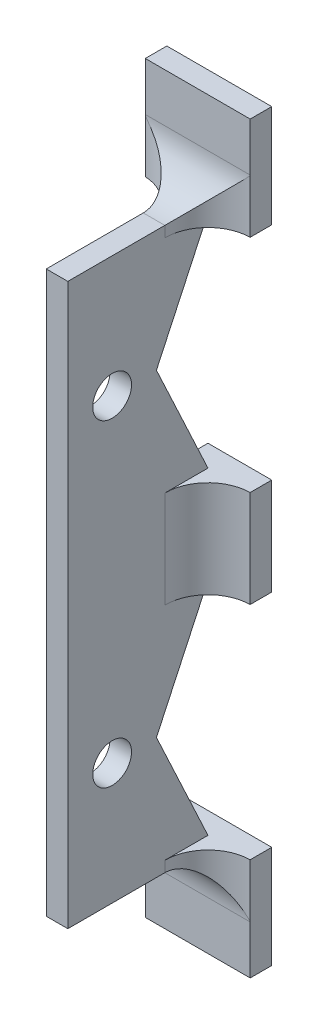
from build123d import *

# Parameters (mm, degrees)
SKETCH2_W             = 5.91625
SKETCH2_H             = 9
BOSS_EXTRUDE1_DEPTH   = 2
SKETCH2_W_2           = 9.732
SKETCH2_H_2           = 9.5
BOSS_EXTRUDE1_2_DEPTH = 2
BOSS_EXTRUDE1_3_DEPTH = 2
SKETCH3_W             = 2
SKETCH3_H             = 1
BOSS_EXTRUDE2_DEPTH   = 13
FILLET1_R             = 4
CUT_EXTRUDE1_DEPTH    = 83.031058661
M3_CLEARANCE_HOLE2_D  = 3.6


with BuildPart() as part:
    # Sketch2 → Boss-Extrude1 (new body)
    with BuildSketch(Plane.XY.offset(11.211435671)):
        with Locations((2.267401673, -43.012787822)):
            Rectangle(SKETCH2_W, SKETCH2_H)
    extrude(amount=BOSS_EXTRUDE1_DEPTH)



with BuildPart() as body_2:
    # Sketch2 → Boss-Extrude1 2 (new body)
    with BuildSketch(Plane.XY.offset(11.211435671)):
        with Locations((0.359526673, -72.762787822)):
            Rectangle(SKETCH2_W_2, SKETCH2_H_2)
    extrude(amount=BOSS_EXTRUDE1_2_DEPTH)


with BuildPart() as body_3:
    # Sketch2 → Boss-Extrude1 3 (new body)
    with BuildSketch(Plane.XY.offset(11.211435671)):
        with Locations((0.359526673, -13.262787822)):
            Rectangle(SKETCH2_W_2, SKETCH2_H_2)
    extrude(amount=BOSS_EXTRUDE1_3_DEPTH)


with BuildPart() as part_1:
    add(part.part)

    add(body_2.part)  # Boss-Extrude2 merges body 2

    add(body_3.part)  # Boss-Extrude2 merges body 3
    # Sketch3 → Boss-Extrude2 (add)
    with BuildSketch(Plane.XY.offset(13.211435671)):
        Polygon((-0.690723327, -17.012787822), (-0.690723327, -38.512787822), (-0.690723327, -47.512787822), (-0.690723327, -68.012787822), (1.309276673, -68.012787822), (1.309276673, -17.012787822), align=None)
        with Locations((0.309276673, -68.512787822)):
            Rectangle(SKETCH3_W, SKETCH3_H)
    extrude(amount=BOSS_EXTRUDE2_DEPTH)

    # Fillet1
    # the kernel refuses this fillet: 4 mm, written as the material it adds along each edge
    with BuildSketch(Plane(origin=(-0.690723327, -17.012787822, 13.211435671), x_dir=(0, 0, 1), z_dir=(0, -1, 0)), Plane(origin=(-0.690723327, -68.012787822, 13.211435671), x_dir=(0, 0, 1), z_dir=(0, -1, 0))) as fillet1_piece_1:
        with BuildLine():
            CenterArc((3.995754239, 4), FILLET1_R, 182.64012102, 87.35987898)
            Line((0, 3.81575), (0, 0))
            Line((0, 0), (3.995754239, 0))
        make_face()
    extrude(amount=1)
    with BuildSketch(Plane(origin=(1.309276673, -17.012787822, 13.211435671), x_dir=(0, 1, 0), z_dir=(-1, 0, 0))) as fillet1_piece_2:
        with BuildLine():
            CenterArc((FILLET1_R, -FILLET1_R), FILLET1_R, 90, 90)
            Line((0, -FILLET1_R), (0, 0))
            Line((0, 0), (FILLET1_R, 0))
        make_face()
    extrude(amount=2)
    with BuildSketch(Plane(origin=(1.309276673, -17.012787822, 13.211435671), x_dir=(1, 0, 0), z_dir=(0, -1, 0))) as fillet1_piece_3_section:
        with BuildLine():
            CenterArc((FILLET1_R, FILLET1_R), FILLET1_R, 180, 90)
            Line((0, FILLET1_R), (0, 0))
            Line((0, 0), (FILLET1_R, 0))
        make_face()
    fillet1_piece_3 = extrude(amount=1, mode=Mode.PRIVATE)
    fillet1_piece_3 = split(fillet1_piece_3, bisect_by=Plane(origin=(5.225526673, -17.012787822, 13.211435671), z_dir=(-1, 0, 0)), keep=Keep.TOP, mode=Mode.PRIVATE)
    add(fillet1_piece_3)
    with BuildSketch(Plane(origin=(1.309276673, -38.512787822, 13.211435671), x_dir=(1, 0, 0), z_dir=(0, -1, 0))) as fillet1_piece_4_section:
        with BuildLine():
            CenterArc((FILLET1_R, FILLET1_R), FILLET1_R, 180, 90)
            Line((0, FILLET1_R), (0, 0))
            Line((0, 0), (FILLET1_R, 0))
        make_face()
    fillet1_piece_4 = extrude(amount=9, mode=Mode.PRIVATE)
    fillet1_piece_4 = split(fillet1_piece_4, bisect_by=Plane(origin=(5.225526673, -38.512787822, 13.211435671), z_dir=(-1, 0, 0)), keep=Keep.TOP, mode=Mode.PRIVATE)
    add(fillet1_piece_4)
    with BuildSketch(Plane(origin=(1.309276673, -68.012787822, 13.211435671), x_dir=(1, 0, 0), z_dir=(0, -1, 0))) as fillet1_piece_5_section:
        with BuildLine():
            CenterArc((FILLET1_R, FILLET1_R), FILLET1_R, 180, 90)
            Line((0, FILLET1_R), (0, 0))
            Line((0, 0), (FILLET1_R, 0))
        make_face()
    fillet1_piece_5 = extrude(amount=1, mode=Mode.PRIVATE)
    fillet1_piece_5 = split(fillet1_piece_5, bisect_by=Plane(origin=(5.225526673, -68.012787822, 13.211435671), z_dir=(-1, 0, 0)), keep=Keep.TOP, mode=Mode.PRIVATE)
    add(fillet1_piece_5)
    with BuildSketch(Plane(origin=(-0.690723327, -69.012787822, 13.211435671), x_dir=(0, 0, 1), z_dir=(1, 0, 0))) as fillet1_piece_6:
        with BuildLine():
            CenterArc((FILLET1_R, FILLET1_R), FILLET1_R, 180, 90)
            Line((0, FILLET1_R), (0, 0))
            Line((0, 0), (FILLET1_R, 0))
        make_face()
    extrude(amount=2)
    with BuildSketch(Plane(origin=(-0.690723327, -7.023402225, 13.211435671), x_dir=(0, 0, 1), z_dir=(0, -1, 0))) as fillet1_piece_7a_section:
        with BuildLine():
            CenterArc((3.995754239, 4), FILLET1_R, 182.64012102, 87.35987898)
            Line((0, 3.81575), (0, 0))
            Line((0, 0), (3.995754239, 0))
        make_face()
    fillet1_piece_7a = extrude(amount=10.989385597, mode=Mode.PRIVATE)
    fillet1_piece_7a = split(fillet1_piece_7a, bisect_by=Plane(origin=(-0.690723327, -17.012787822, 13.211435671), z_dir=(0, 1, 0)), keep=Keep.TOP, mode=Mode.PRIVATE)
    fillet1_piece_7a = split(fillet1_piece_7a, bisect_by=Plane(origin=(-0.690723327, -8.512787822, 13.211435671), z_dir=(0, -1, 0)), keep=Keep.TOP, mode=Mode.PRIVATE)
    with BuildSketch(Plane(origin=(1.309276673, -17.012787822, 13.211435671), x_dir=(0, 1, 0), z_dir=(-1, 0, 0))) as fillet1_piece_7b_section:
        with BuildLine():
            CenterArc((FILLET1_R, -FILLET1_R), FILLET1_R, 90, 90)
            Line((0, -FILLET1_R), (0, 0))
            Line((0, 0), (FILLET1_R, 0))
        make_face()
    fillet1_piece_7b = extrude(amount=12, mode=Mode.PRIVATE)
    fillet1_piece_7b = split(fillet1_piece_7b, bisect_by=Plane(origin=(-0.690723327, -17.012787822, 13.211435671), z_dir=(-1, 0, 0)), keep=Keep.TOP, mode=Mode.PRIVATE)
    fillet1_piece_7b = split(fillet1_piece_7b, bisect_by=Plane(origin=(-4.506473327, -17.012787822, 13.211435671), z_dir=(1, 0, 0)), keep=Keep.TOP, mode=Mode.PRIVATE)
    fillet1_piece_7 = fillet1_piece_7a & fillet1_piece_7b
    add(fillet1_piece_7)
    with BuildSketch(Plane(origin=(1.309276673, -7.012787822, 13.211435671), x_dir=(1, 0, 0), z_dir=(0, -1, 0))) as fillet1_piece_8a_section:
        with BuildLine():
            CenterArc((FILLET1_R, FILLET1_R), FILLET1_R, 180, 90)
            Line((0, FILLET1_R), (0, 0))
            Line((0, 0), (FILLET1_R, 0))
        make_face()
    fillet1_piece_8a = extrude(amount=11, mode=Mode.PRIVATE)
    fillet1_piece_8a = split(fillet1_piece_8a, bisect_by=Plane(origin=(1.309276673, -17.012787822, 13.211435671), z_dir=(0, 1, 0)), keep=Keep.TOP, mode=Mode.PRIVATE)
    fillet1_piece_8a = split(fillet1_piece_8a, bisect_by=Plane(origin=(1.309276673, -8.512787822, 13.211435671), z_dir=(0, -1, 0)), keep=Keep.TOP, mode=Mode.PRIVATE)
    with BuildSketch(Plane(origin=(11.309276673, -17.012787822, 13.211435671), x_dir=(0, 1, 0), z_dir=(-1, 0, 0))) as fillet1_piece_8b_section:
        with BuildLine():
            CenterArc((FILLET1_R, -FILLET1_R), FILLET1_R, 90, 90)
            Line((0, -FILLET1_R), (0, 0))
            Line((0, 0), (FILLET1_R, 0))
        make_face()
    fillet1_piece_8b = extrude(amount=12, mode=Mode.PRIVATE)
    fillet1_piece_8b = split(fillet1_piece_8b, bisect_by=Plane(origin=(1.309276673, -17.012787822, 13.211435671), z_dir=(1, 0, 0)), keep=Keep.TOP, mode=Mode.PRIVATE)
    fillet1_piece_8b = split(fillet1_piece_8b, bisect_by=Plane(origin=(5.225526673, -17.012787822, 13.211435671), z_dir=(-1, 0, 0)), keep=Keep.TOP, mode=Mode.PRIVATE)
    fillet1_piece_8 = fillet1_piece_8a & fillet1_piece_8b
    add(fillet1_piece_8)
    with BuildSketch(Plane(origin=(-0.690723327, -68.012787822, 13.211435671), x_dir=(0, 0, 1), z_dir=(0, -1, 0))) as fillet1_piece_9a_section:
        with BuildLine():
            CenterArc((3.995754239, 4), FILLET1_R, 182.64012102, 87.35987898)
            Line((0, 3.81575), (0, 0))
            Line((0, 0), (3.995754239, 0))
        make_face()
    fillet1_piece_9a = extrude(amount=10.989385597, mode=Mode.PRIVATE)
    fillet1_piece_9a = split(fillet1_piece_9a, bisect_by=Plane(origin=(-0.690723327, -69.012787822, 13.211435671), z_dir=(0, -1, 0)), keep=Keep.TOP, mode=Mode.PRIVATE)
    fillet1_piece_9a = split(fillet1_piece_9a, bisect_by=Plane(origin=(-0.690723327, -77.512787822, 13.211435671), z_dir=(0, 1, 0)), keep=Keep.TOP, mode=Mode.PRIVATE)
    with BuildSketch(Plane(origin=(-10.690723327, -69.012787822, 13.211435671), x_dir=(0, 0, 1), z_dir=(1, 0, 0))) as fillet1_piece_9b_section:
        with BuildLine():
            CenterArc((FILLET1_R, FILLET1_R), FILLET1_R, 180, 90)
            Line((0, FILLET1_R), (0, 0))
            Line((0, 0), (FILLET1_R, 0))
        make_face()
    fillet1_piece_9b = extrude(amount=12, mode=Mode.PRIVATE)
    fillet1_piece_9b = split(fillet1_piece_9b, bisect_by=Plane(origin=(-0.690723327, -69.012787822, 13.211435671), z_dir=(-1, 0, 0)), keep=Keep.TOP, mode=Mode.PRIVATE)
    fillet1_piece_9b = split(fillet1_piece_9b, bisect_by=Plane(origin=(-4.506473327, -69.012787822, 13.211435671), z_dir=(1, 0, 0)), keep=Keep.TOP, mode=Mode.PRIVATE)
    fillet1_piece_9 = fillet1_piece_9a & fillet1_piece_9b
    add(fillet1_piece_9)
    with BuildSketch(Plane(origin=(-0.690723327, -69.012787822, 13.211435671), x_dir=(0, 0, 1), z_dir=(1, 0, 0))) as fillet1_piece_10a_section:
        with BuildLine():
            CenterArc((FILLET1_R, FILLET1_R), FILLET1_R, 180, 90)
            Line((0, FILLET1_R), (0, 0))
            Line((0, 0), (FILLET1_R, 0))
        make_face()
    fillet1_piece_10a = extrude(amount=12, mode=Mode.PRIVATE)
    fillet1_piece_10a = split(fillet1_piece_10a, bisect_by=Plane(origin=(1.309276673, -69.012787822, 13.211435671), z_dir=(1, 0, 0)), keep=Keep.TOP, mode=Mode.PRIVATE)
    fillet1_piece_10a = split(fillet1_piece_10a, bisect_by=Plane(origin=(5.225526673, -69.012787822, 13.211435671), z_dir=(-1, 0, 0)), keep=Keep.TOP, mode=Mode.PRIVATE)
    with BuildSketch(Plane(origin=(1.309276673, -68.012787822, 13.211435671), x_dir=(1, 0, 0), z_dir=(0, -1, 0))) as fillet1_piece_10b_section:
        with BuildLine():
            CenterArc((FILLET1_R, FILLET1_R), FILLET1_R, 180, 90)
            Line((0, FILLET1_R), (0, 0))
            Line((0, 0), (FILLET1_R, 0))
        make_face()
    fillet1_piece_10b = extrude(amount=11, mode=Mode.PRIVATE)
    fillet1_piece_10b = split(fillet1_piece_10b, bisect_by=Plane(origin=(1.309276673, -69.012787822, 13.211435671), z_dir=(0, -1, 0)), keep=Keep.TOP, mode=Mode.PRIVATE)
    fillet1_piece_10b = split(fillet1_piece_10b, bisect_by=Plane(origin=(1.309276673, -77.512787822, 13.211435671), z_dir=(0, 1, 0)), keep=Keep.TOP, mode=Mode.PRIVATE)
    fillet1_piece_10 = fillet1_piece_10a & fillet1_piece_10b
    add(fillet1_piece_10)

    # Sketch6 → Cut-Extrude1 (cut, through all)
    with BuildSketch(Plane(origin=(1.309276673, 0, 0), x_dir=(0, 0, -1), z_dir=(1, 0, 0))):
        Polygon((-13.211435671, -18.012787822), (-17.991089167, -28.262787822), (-13.211435671, -38.512787822), align=None)
        Polygon((-17.991089167, -57.762787822), (-13.211435671, -47.512787822), (-13.211435671, -68.012787822), align=None)
    extrude(amount=-CUT_EXTRUDE1_DEPTH, mode=Mode.SUBTRACT)

    # M3 Clearance Hole2 (through all)
    with Locations(Plane(origin=(1.309276673, 0, 0), x_dir=(0, 0, -1), z_dir=(1, 0, 0))):
        with Locations((-22.101262419, -28.262787822), (-22.101262419, -57.762787822)):
            Hole(M3_CLEARANCE_HOLE2_D / 2)


solid = part_1.part
